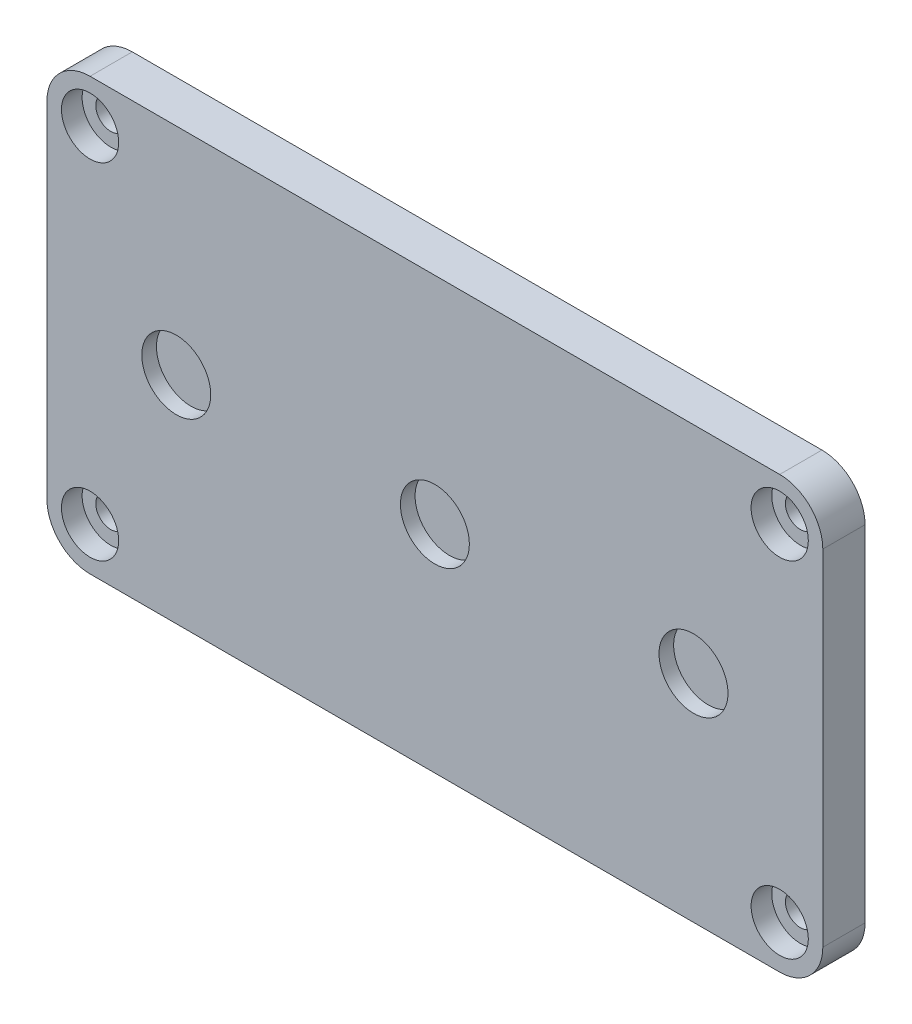
from build123d import *

# Parameters (mm, degrees)
SKETCH1_R           = 2.2098
BOSS_EXTRUDE1_DEPTH = 6.223
SKETCH2_R           = 4.2164
CUT_EXTRUDE1_DEPTH  = 3.048
SKETCH3_R           = 5.08
CUT_EXTRUDE2_DEPTH  = 2.159


with BuildPart() as part:
    # Sketch1 → Boss-Extrude1 (new body)
    with BuildSketch(Plane.XY):
        with BuildLine():
            Line((-50.8, -31.75), (50.8, -31.75))
            ThreePointArc((50.8, -31.75), (55.290128061, -29.890128061), (57.15, -25.4))
            Line((57.15, -25.4), (57.15, 25.4))
            ThreePointArc((57.15, 25.4), (55.290128061, 29.890128061), (50.8, 31.75))
            Line((50.8, 31.75), (-50.8, 31.75))
            ThreePointArc((-50.8, 31.75), (-55.290128061, 29.890128061), (-57.15, 25.4))
            Line((-57.15, 25.4), (-57.15, -25.4))
            ThreePointArc((-57.15, -25.4), (-55.290128061, -29.890128061), (-50.8, -31.75))
        make_face()
        with Locations((-50.8, -25.4)):
            Circle(SKETCH1_R, mode=Mode.SUBTRACT)
        with Locations((-50.8, 25.4)):
            Circle(SKETCH1_R, mode=Mode.SUBTRACT)
        with Locations((50.8, 25.4)):
            Circle(SKETCH1_R, mode=Mode.SUBTRACT)
        with Locations((50.8, -25.4)):
            Circle(SKETCH1_R, mode=Mode.SUBTRACT)
    extrude(amount=BOSS_EXTRUDE1_DEPTH)

    # Sketch2 → Cut-Extrude1 (cut)
    with BuildSketch(Plane.XY.offset(6.223)):
        with Locations((-50.8, 25.4)):
            Circle(SKETCH2_R)
        with Locations((50.8, 25.4)):
            Circle(SKETCH2_R)
        with Locations((50.8, -25.4)):
            Circle(SKETCH2_R)
        with Locations((-50.8, -25.4)):
            Circle(SKETCH2_R)
    extrude(amount=-CUT_EXTRUDE1_DEPTH, mode=Mode.SUBTRACT)

    # Sketch3 → Cut-Extrude2 (cut)
    with BuildSketch(Plane.XY.offset(6.223)):
        Circle(SKETCH3_R)
        with Locations((38.1, 0)):
            Circle(SKETCH3_R)
        with Locations((-38.1, 0)):
            Circle(SKETCH3_R)
    extrude(amount=-CUT_EXTRUDE2_DEPTH, mode=Mode.SUBTRACT)


solid = part.part
